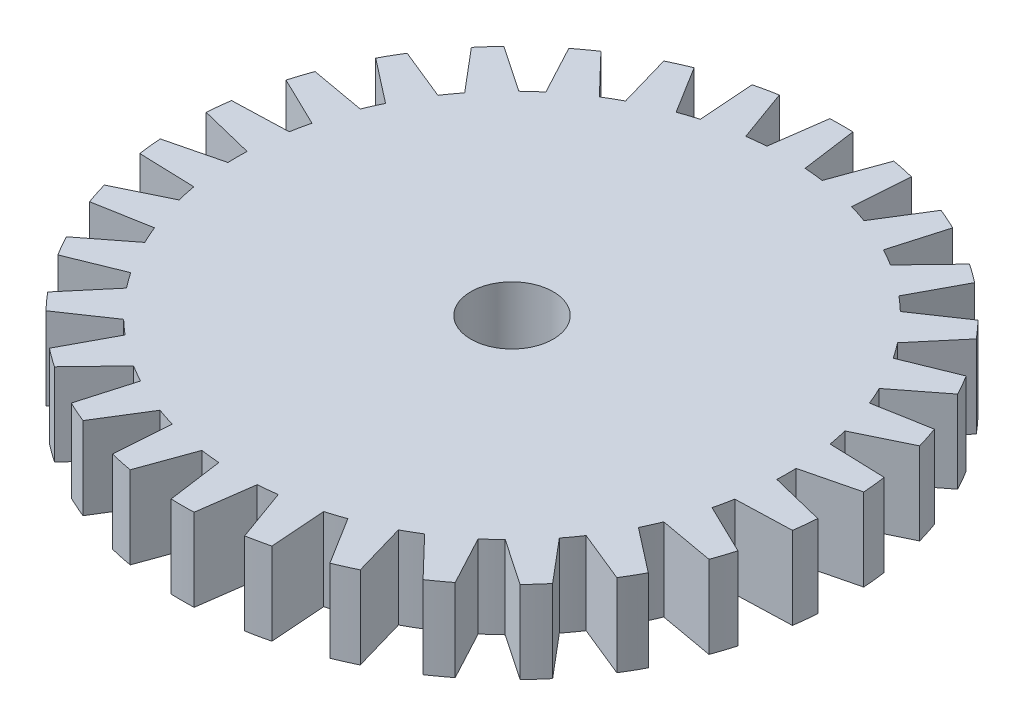
from build123d import *

# Parameters (mm, degrees)
BOSS_EXTRUDE1_DEPTH = 3
SKETCH2_R           = 1.5
CUT_EXTRUDE1_DEPTH  = 19.687346924


with BuildPart() as part:
    # Sketch1 → Boss-Extrude1 (new body)
    with BuildSketch(Plane(origin=(0, 0, 0), x_dir=(1, 0, 0), z_dir=(0, 1, 0))):
        with BuildLine():
            Line((-2.450111074, 11.986086298), (-2.728881851, 9.969036876))
            ThreePointArc((-2.728881851, 9.969036876), (-3.076601747, 9.938615328), (-3.423048124, 9.896077061))
            Line((-3.423048124, 9.896077061), (-4.115095246, 11.81108941))
            ThreePointArc((-4.115095246, 11.81108941), (-4.526257404, 11.731167583), (-4.934379861, 11.636945089))
            Line((-4.934379861, 11.636945089), (-4.787690672, 9.606013333))
            ThreePointArc((-4.787690672, 9.606013333), (-5.121487058, 9.503961537), (-5.451518547, 9.390322582))
            Line((-5.451518547, 9.390322582), (-6.526596235, 11.119602629))
            ThreePointArc((-6.526596235, 11.119602629), (-6.912156831, 10.955941866), (-7.291770876, 10.778924929))
            Line((-7.291770876, 10.778924929), (-6.726032742, 8.822872302))
            ThreePointArc((-6.726032742, 8.822872302), (-7.031317114, 8.653650412), (-7.330509756, 8.473877335))
            Line((-7.330509756, 8.473877335), (-8.741631956, 9.941847245))
            ThreePointArc((-8.741631956, 9.941847245), (-9.084740142, 9.701600306), (-9.419254818, 9.449525417))
            Line((-9.419254818, 9.449525417), (-8.459193211, 7.653840805))
            ThreePointArc((-8.459193211, 7.653840805), (-8.722623178, 7.424844629), (-8.977900819, 7.186794377))
            Line((-8.977900819, 7.186794377), (-10.663394718, 8.329296819))
            ThreePointArc((-10.663394718, 8.329296819), (-10.94905502, 8.02296365), (-11.223850431, 7.70684769))
            Line((-11.223850431, 7.70684769), (-9.91142465, 6.150011127))
            ThreePointArc((-9.91142465, 6.150011127), (-10.121487058, 5.871248897), (-10.32169284, 5.585325409))
            Line((-10.32169284, 5.585325409), (-12.207894268, 6.352427545))
            ThreePointArc((-12.207894268, 6.352427545), (-12.423621959, 5.993396374), (-12.626688228, 5.627055127))
            Line((-12.626688228, 5.627055127), (-11.019257577, 4.377107842))
            ThreePointArc((-11.019257577, 4.377107842), (-11.16677169, 4.060762805), (-11.30315566, 3.739462308))
            Line((-11.30315566, 3.739462308), (-13.307628563, 4.097638094))
            ThreePointArc((-13.307628563, 4.097638094), (-13.44399531, 3.701600306), (-13.566457465, 3.301044644))
            Line((-13.566457465, 3.301044644), (-11.734274377, 2.41261533))
            ThreePointArc((-11.734274377, 2.41261533), (-11.812793121, 2.072513282), (-11.879394644, 1.729878151))
            Line((-11.879394644, 1.729878151), (-13.914533939, 1.663473585))
            ThreePointArc((-13.914533939, 1.663473585), (-13.965579858, 1.247737933), (-14.002085717, 0.830474059))
            Line((-14.002085717, 0.830474059), (-12.025225384, 0.342391341))
            ThreePointArc((-12.025225384, 0.342391341), (-12.031317114, -0.006603626), (-12.025225384, -0.355598593))
            Line((-12.025225384, -0.355598593), (-14.002085717, -0.843681311))
            ThreePointArc((-14.002085717, -0.843681311), (-13.965579858, -1.260945185), (-13.914533939, -1.676680838))
            Line((-13.914533939, -1.676680838), (-11.879394644, -1.743085403))
            ThreePointArc((-11.879394644, -1.743085403), (-11.812793121, -2.085720534), (-11.734274377, -2.425822582))
            Line((-11.734274377, -2.425822582), (-13.566457465, -3.314251896))
            ThreePointArc((-13.566457465, -3.314251896), (-13.44399531, -3.714807559), (-13.307628563, -4.110845346))
            Line((-13.307628563, -4.110845346), (-11.30315566, -3.75266956))
            ThreePointArc((-11.30315566, -3.75266956), (-11.16677169, -4.073970057), (-11.019257577, -4.390315094))
            Line((-11.019257577, -4.390315094), (-12.626688228, -5.64026238))
            ThreePointArc((-12.626688228, -5.64026238), (-12.423621959, -6.006603626), (-12.207894268, -6.365634797))
            Line((-12.207894268, -6.365634797), (-10.32169284, -5.598532661))
            ThreePointArc((-10.32169284, -5.598532661), (-10.121487058, -5.884456149), (-9.91142465, -6.163218379))
            Line((-9.91142465, -6.163218379), (-11.223850431, -7.720054942))
            ThreePointArc((-11.223850431, -7.720054942), (-10.94905502, -8.036170902), (-10.663394718, -8.342504072))
            Line((-10.663394718, -8.342504072), (-8.977900819, -7.20000163))
            ThreePointArc((-8.977900819, -7.20000163), (-8.722623178, -7.438051881), (-8.459193211, -7.667048057))
            Line((-8.459193211, -7.667048057), (-9.419254818, -9.462732669))
            ThreePointArc((-9.419254818, -9.462732669), (-9.084740142, -9.714807559), (-8.741631956, -9.955054497))
            Line((-8.741631956, -9.955054497), (-7.330509756, -8.487084588))
            ThreePointArc((-7.330509756, -8.487084588), (-7.031317114, -8.666857664), (-6.726032742, -8.836079555))
            Line((-6.726032742, -8.836079555), (-7.291770876, -10.792132182))
            ThreePointArc((-7.291770876, -10.792132182), (-6.912156831, -10.969149118), (-6.526596235, -11.132809881))
            Line((-6.526596235, -11.132809881), (-5.451518547, -9.403529834))
            ThreePointArc((-5.451518547, -9.403529834), (-5.121487058, -9.517168789), (-4.787690672, -9.619220586))
            Line((-4.787690672, -9.619220586), (-4.934379861, -11.650152341))
            ThreePointArc((-4.934379861, -11.650152341), (-4.526257404, -11.744374835), (-4.115095246, -11.824296662))
            Line((-4.115095246, -11.824296662), (-3.423048124, -9.909284314))
            ThreePointArc((-3.423048124, -9.909284314), (-3.076601747, -9.95182258), (-2.728881851, -9.982244129))
            Line((-2.728881851, -9.982244129), (-2.450111074, -11.99929355))
            ThreePointArc((-2.450111074, -11.99929355), (-2.031317114, -12.006603626), (-1.612523154, -11.99929355))
            Line((-1.612523154, -11.99929355), (-1.333752377, -9.982244129))
            ThreePointArc((-1.333752377, -9.982244129), (-0.986032481, -9.95182258), (-0.639586104, -9.909284314))
            Line((-0.639586104, -9.909284314), (0.052461018, -11.824296662))
            ThreePointArc((0.052461018, -11.824296662), (0.463623176, -11.744374835), (0.871745633, -11.650152341))
            Line((0.871745633, -11.650152341), (0.725056444, -9.619220586))
            ThreePointArc((0.725056444, -9.619220586), (1.05885283, -9.517168789), (1.388884319, -9.403529834))
            Line((1.388884319, -9.403529834), (2.463962007, -11.132809881))
            ThreePointArc((2.463962007, -11.132809881), (2.849522603, -10.969149118), (3.229136647, -10.792132182))
            Line((3.229136647, -10.792132182), (2.663398514, -8.836079555))
            ThreePointArc((2.663398514, -8.836079555), (2.968682886, -8.666857664), (3.267875528, -8.487084588))
            Line((3.267875528, -8.487084588), (4.678997728, -9.955054497))
            ThreePointArc((4.678997728, -9.955054497), (5.022105913, -9.714807559), (5.35662059, -9.462732669))
            Line((5.35662059, -9.462732669), (4.396558983, -7.667048057))
            ThreePointArc((4.396558983, -7.667048057), (4.65998895, -7.438051881), (4.915266591, -7.20000163))
            Line((4.915266591, -7.20000163), (6.60076049, -8.342504072))
            ThreePointArc((6.60076049, -8.342504072), (6.886420792, -8.036170902), (7.161216203, -7.720054942))
            Line((7.161216203, -7.720054942), (5.848790422, -6.163218379))
            ThreePointArc((5.848790422, -6.163218379), (6.05885283, -5.884456149), (6.259058612, -5.598532661))
            Line((6.259058612, -5.598532661), (8.14526004, -6.365634797))
            ThreePointArc((8.14526004, -6.365634797), (8.360987731, -6.006603626), (8.564054, -5.64026238))
            Line((8.564054, -5.64026238), (6.956623349, -4.390315094))
            ThreePointArc((6.956623349, -4.390315094), (7.104137462, -4.073970057), (7.240521432, -3.75266956))
            Line((7.240521432, -3.75266956), (9.244994335, -4.110845346))
            ThreePointArc((9.244994335, -4.110845346), (9.381361081, -3.714807559), (9.503823237, -3.314251896))
            Line((9.503823237, -3.314251896), (7.671640149, -2.425822582))
            ThreePointArc((7.671640149, -2.425822582), (7.750158893, -2.085720534), (7.816760416, -1.743085403))
            Line((7.816760416, -1.743085403), (9.851899711, -1.676680838))
            ThreePointArc((9.851899711, -1.676680838), (9.90294563, -1.260945185), (9.939451489, -0.843681311))
            Line((9.939451489, -0.843681311), (7.962591156, -0.355598593))
            ThreePointArc((7.962591156, -0.355598593), (7.968682886, -0.006603626), (7.962591156, 0.342391341))
            Line((7.962591156, 0.342391341), (9.939451489, 0.830474059))
            ThreePointArc((9.939451489, 0.830474059), (9.90294563, 1.247737933), (9.851899711, 1.663473585))
            Line((9.851899711, 1.663473585), (7.816760416, 1.729878151))
            ThreePointArc((7.816760416, 1.729878151), (7.750158893, 2.072513282), (7.671640149, 2.41261533))
            Line((7.671640149, 2.41261533), (9.503823237, 3.301044644))
            ThreePointArc((9.503823237, 3.301044644), (9.381361081, 3.701600306), (9.244994335, 4.097638094))
            Line((9.244994335, 4.097638094), (7.240521432, 3.739462308))
            ThreePointArc((7.240521432, 3.739462308), (7.104137462, 4.060762805), (6.956623349, 4.377107842))
            Line((6.956623349, 4.377107842), (8.564054, 5.627055127))
            ThreePointArc((8.564054, 5.627055127), (8.360987731, 5.993396374), (8.14526004, 6.352427545))
            Line((8.14526004, 6.352427545), (6.259058612, 5.585325409))
            ThreePointArc((6.259058612, 5.585325409), (6.05885283, 5.871248897), (5.848790422, 6.150011127))
            Line((5.848790422, 6.150011127), (7.161216203, 7.70684769))
            ThreePointArc((7.161216203, 7.70684769), (6.886420792, 8.02296365), (6.60076049, 8.329296819))
            Line((6.60076049, 8.329296819), (4.915266591, 7.186794377))
            ThreePointArc((4.915266591, 7.186794377), (4.65998895, 7.424844629), (4.396558983, 7.653840805))
            Line((4.396558983, 7.653840805), (5.35662059, 9.449525417))
            ThreePointArc((5.35662059, 9.449525417), (5.022105913, 9.701600306), (4.678997728, 9.941847245))
            Line((4.678997728, 9.941847245), (3.267875528, 8.473877335))
            ThreePointArc((3.267875528, 8.473877335), (2.968682886, 8.653650412), (2.663398514, 8.822872302))
            Line((2.663398514, 8.822872302), (3.229136647, 10.778924929))
            ThreePointArc((3.229136647, 10.778924929), (2.849522603, 10.955941866), (2.463962007, 11.119602629))
            Line((2.463962007, 11.119602629), (1.388884319, 9.390322582))
            ThreePointArc((1.388884319, 9.390322582), (1.05885283, 9.503961537), (0.725056444, 9.606013333))
            Line((0.725056444, 9.606013333), (0.871745633, 11.636945089))
            ThreePointArc((0.871745633, 11.636945089), (0.463623176, 11.731167583), (0.052461018, 11.81108941))
            Line((0.052461018, 11.81108941), (-0.639586104, 9.896077061))
            ThreePointArc((-0.639586104, 9.896077061), (-0.986032481, 9.938615328), (-1.333752377, 9.969036876))
            Line((-1.333752377, 9.969036876), (-1.612523154, 11.986086298))
            ThreePointArc((-1.612523154, 11.986086298), (-2.031317114, 11.993396374), (-2.450111074, 11.986086298))
        make_face()
    extrude(amount=BOSS_EXTRUDE1_DEPTH)

    # Sketch2 → Cut-Extrude1 (cut, through all)
    with BuildSketch(Plane(origin=(0, 3, 0), x_dir=(1, 0, 0), z_dir=(0, 1, 0))):
        with Locations((-2.031317114, -0.006603626)):
            Circle(SKETCH2_R)
    extrude(amount=-CUT_EXTRUDE1_DEPTH, mode=Mode.SUBTRACT)


solid = part.part
